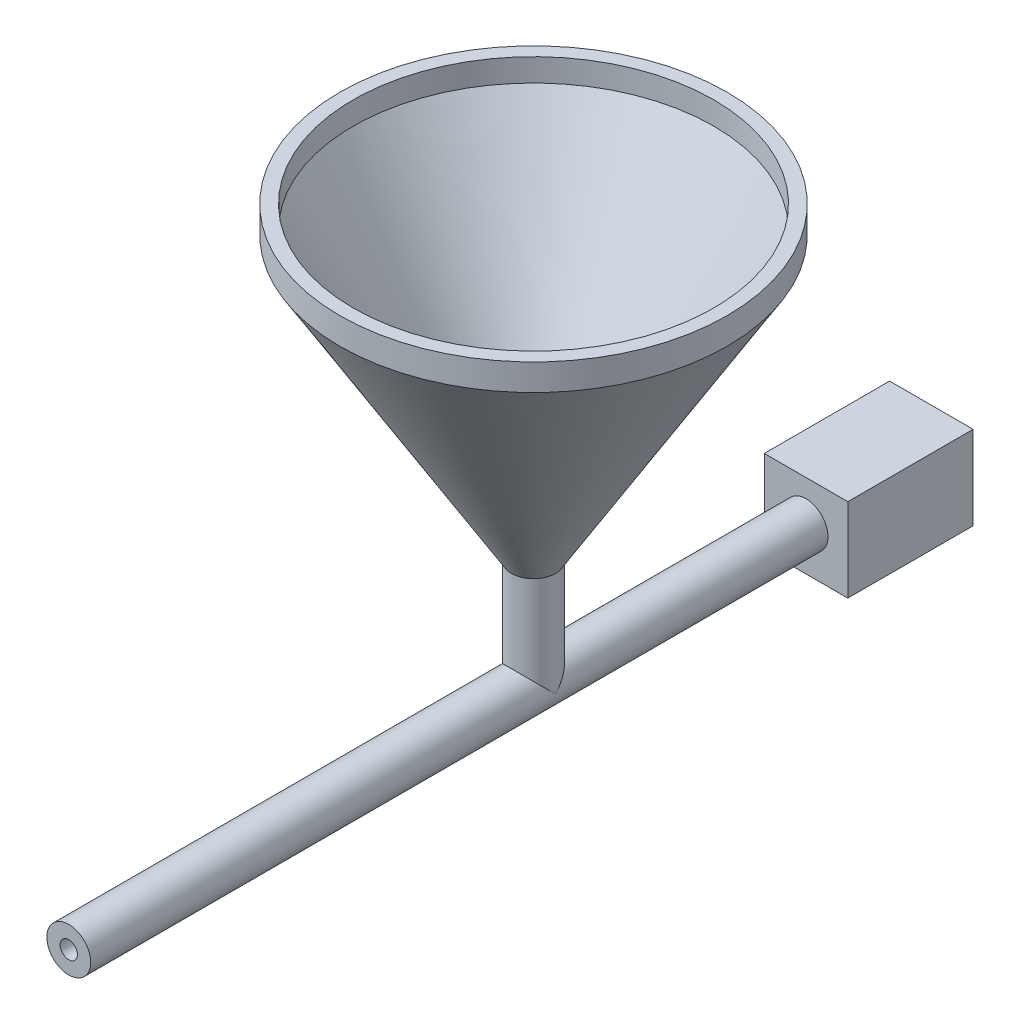
from build123d import *

# Parameters (mm, degrees)
CROQUIS1_R                   = 92.69375
SALIENTE_EXTRUIR1_DEPTH      = 12.7
CROQUIS3_R                   = 10.5
CROQUIS2_R                   = 92.69375
CROQUIS4_R                   = 10.5
SALIENTE_EXTRUIR2_DEPTH      = 50
SALIENTE_EXTRUIR3_DEPTH      = 120
SALIENTE_EXTRUIR3_DEPTH_BACK = 233
CROQUIS5_R                   = 10.5
CROQUIS6_W                   = 40
CROQUIS6_H                   = 40
SALIENTE_EXTRUIR4_DEPTH      = 60


with BuildPart() as part:
    # Croquis1 → Saliente-Extruir1 (new body)
    with BuildSketch(Plane(origin=(0, 0, 0), x_dir=(1, 0, 0), z_dir=(0, 1, 0))):
        with Locations(Location((0, 0, 0), (0, 0, 270))):
            Circle(CROQUIS1_R)
    extrude(amount=-SALIENTE_EXTRUIR1_DEPTH)

    # Croquis3 → Recubrir1 section 0
    with BuildSketch(Plane(origin=(0, -148, 0), x_dir=(1, 0, 0), z_dir=(0, 1, 0))):
        Circle(CROQUIS3_R)
    # Croquis2 → Recubrir1 section 1
    with BuildSketch(Plane.XZ.offset(12.7)):
        Circle(CROQUIS2_R)
    loft()

    # Croquis4 → Saliente-Extruir2 (add)
    with BuildSketch(Plane.XZ.offset(148)):
        with Locations(Location((0, 0, 0), (0, 0, 270))):
            Circle(CROQUIS4_R)
    extrude(amount=SALIENTE_EXTRUIR2_DEPTH)

    # Croquis5 → Saliente-Extruir3 (add, two sides: drawn at the far end of the back side and taken through both)
    with BuildSketch(Plane(origin=(0, 0, -10.5), x_dir=(-1, 0, 0), z_dir=(0, 0, -1)).offset(-SALIENTE_EXTRUIR3_DEPTH_BACK)):
        with Locations((0, -198)):
            Circle(CROQUIS5_R)
    extrude(amount=SALIENTE_EXTRUIR3_DEPTH + SALIENTE_EXTRUIR3_DEPTH_BACK)

    # Vaciado1: read off the stored shape, not the designer's step
    # Vaciado1 outline → Vaciado1 (revolve, cut)
    with BuildSketch(Plane.XY):
        Polygon((0, -198), (4.15, -198), (4.15, -146.22236581), (86.34375, -10.92236581), (86.34375, 0), (0, 0), align=None)
    revolve(axis=Axis((0, 0, 0), (0, 1, 0)), mode=Mode.SUBTRACT)

    # Vaciado1 2: loft between two sections, ruled curve by curve
    vaciado1_2_from = [
        Edge.make_three_point_arc((-4.15, -198, -124.15), (0, -202.15, -124.15), (4.15, -198, -124.15)),
        Edge.make_three_point_arc((4.15, -198, -124.15), (0, -193.85, -124.15), (-4.15, -198, -124.15)),
    ]
    vaciado1_2_to = [
        Edge.make_three_point_arc((-4.15, -198, 222.5), (0, -202.15, 222.5), (4.15, -198, 222.5)),
        Edge.make_three_point_arc((4.15, -198, 222.5), (0, -193.85, 222.5), (-4.15, -198, 222.5)),
    ]
    vaciado1_2 = Solid(Shell([*[Face.make_surface_from_curves(vaciado1_2_from[k], vaciado1_2_to[k]) for k in range(2)], Face(Wire(vaciado1_2_from)), Face(Wire(vaciado1_2_to))]))
    add(vaciado1_2, mode=Mode.SUBTRACT)


with BuildPart() as body_2:
    # Croquis6 → Saliente-Extruir4 (new body)
    with BuildSketch(Plane(origin=(0, 0, -130.5), x_dir=(-1, 0, 0), z_dir=(0, 0, -1))):
        with Locations((0, -198.710342853)):
            Rectangle(CROQUIS6_W, CROQUIS6_H)
    extrude(amount=SALIENTE_EXTRUIR4_DEPTH)


solid = Compound([part.part, body_2.part])
